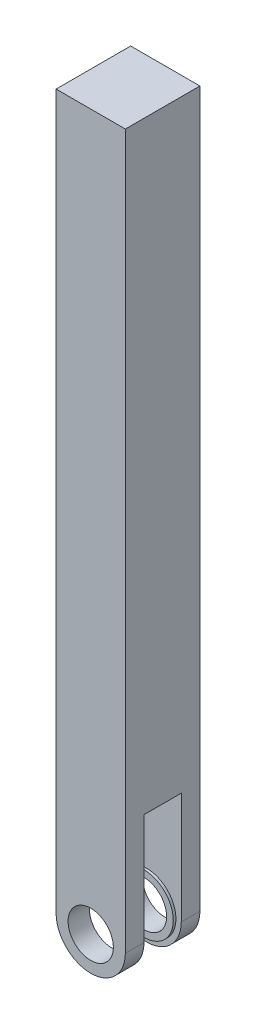
from build123d import *

# Parameters (mm, degrees)
BOSS_EXTRUDE1_DEPTH = 26
SKETCH4_R           = 8.5
CUT_EXTRUDE1_DEPTH  = 33
FILLET1_R           = 13
SKETCH5_R           = 11
SKETCH5_R_2         = 8.5
BOSS_EXTRUDE2_DEPTH = 8


with BuildPart() as part:
    # Sketch3 → Boss-Extrude1 (new body)
    with BuildSketch(Plane(origin=(0, 0, 0), x_dir=(0, 0, -1), z_dir=(1, 0, 0))):
        Polygon((-91.872113318, -345.981347093), (-105.872113318, -345.981347093), (-105.872113318, -400.567582276), (-112.872113318, -400.567582276), (-112.872113318, -369.669881287), (-112.872113318, -119.459461353), (-84.872113318, -119.459461353), (-84.872113318, -369.669881287), (-84.872113318, -400.882361345), (-91.872113318, -400.882361345), align=None)
    extrude(amount=BOSS_EXTRUDE1_DEPTH)

    # Sketch4 → Cut-Extrude1 (cut)
    with BuildSketch(Plane.XY.offset(112.872113318)):
        with Locations((13, -387.882361345)):
            Circle(SKETCH4_R)
    extrude(amount=-CUT_EXTRUDE1_DEPTH, mode=Mode.SUBTRACT)

    # Fillet1
    fillet1_edges = [part.edges().sort_by_distance(p)[0] for p in [
        (26, -400.567582276, 109.372113318),
        (26, -400.882361345, 88.372113318),
        (0, -400.567582276, 109.372113318),
        (0, -400.882361345, 88.372113318),
    ]]
    fillet(fillet1_edges, radius=FILLET1_R - 0.0001)  # a hair under: the kernel refuses the full size

    # Sketch5 → Boss-Extrude2 (add)
    with BuildSketch(Plane.XY.offset(112.872113318)):
        with Locations((13, -387.882361345)):
            Circle(SKETCH5_R)
        with Locations((13, -387.882361345)):
            Circle(SKETCH5_R_2, mode=Mode.SUBTRACT)
    boss_extrude2 = extrude(amount=-BOSS_EXTRUDE2_DEPTH)

    # Mirror1: Boss-Extrude2 across plane
    add(boss_extrude2.mirror(Plane.XY.offset(98.872113318)))


solid = part.part
